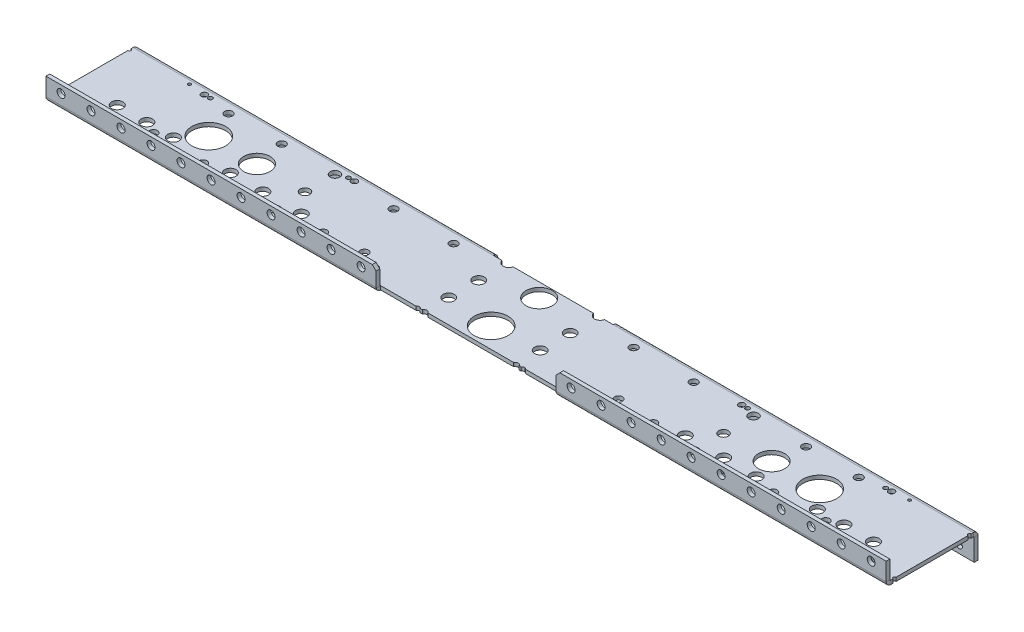
from build123d import *

# Parameters (mm, degrees)
SKETCH1_W                              = 812.8
SKETCH1_H                              = 69.85
BOSS_EXTRUDE1_DEPTH                    = 3.175
SKETCH3_R                              = 14.2875
CUT_EXTRUDE1_DEPTH                     = 816.802024467
EDGE_FLANGE1_DEPTH                     = 812.8
EDGE_FLANGE2_DEPTH                     = 812.8
SKETCH10_R                             = 4.826
LONG_6WD_DEPTH                         = 817.444922817
SKETCH11_R                             = 4.826
SHORT_6WD_DEPTH                        = 817.444922817
SKETCH12_R                             = 3.3528
F_8WD_EGG_DEPTH                        = 817.444922817
SKETCH13_R                             = 3.3528
LOWER_CHURRO_DEPTH                     = 817.444922817
SKETCH14_R                             = 2.667
UPPER_FLANGE_HP_DEPTH                  = 817.729920277
SKETCH16_R                             = 3.3528
LOWER_FLANGE_HP_DEPTH                  = 817.433889486
LPATTERN1_COUNT                        = 32
LPATTERN1_PITCH                        = 25.4
SKETCH17_W                             = 152.4
SKETCH17_H                             = 6.35
CUT_EXTRUDE9_DEPTH                     = 818.031193633
SKETCH18_W                             = 146.05
SKETCH18_H                             = 3.175
BOSS_EXTRUDE2_DEPTH                    = 19.05
SKETCH19_W                             = 101.6
SKETCH19_H                             = 3.937
CUT_EXTRUDE10_DEPTH                    = 818.031193633
SKETCH20_W                             = 95.25
SKETCH20_H                             = 3.175
BOSS_EXTRUDE3_DEPTH                    = 27.432
CUT_EXTRUDE14_DEPTH                    = 819.902667079
SKETCH21_R                             = 11.1125
SKETCH21_R_2                           = 4.7625
SKETCH21_R_3                           = 2.54
SKETCH21_R_4                           = 2.032
TB_MINI_SHAFT_PLATE_DEPTH              = 819.8226487
CUT_EXTRUDE12_DEPTH                    = 819.8226487
SKETCH23_R                             = 3.3528
UPPER_INTERNAL_CHIRRO_HP_DEPTH         = 819.8226487
SKETCH24_R                             = 1.27
CUTTING_GUIDES_DEPTH                   = 819.8226487
SKETCH26_R                             = 3.4036
SONIC_MOUNTING_HOLES_DEPTH             = 819.902667079
SKETCH29_R                             = 2.5527
SKETCH29_R_2                           = 1.7859375
SKETCH29_R_3                           = 14.2875
SKETCH29_R_4                           = 11.1125
SKETCH29_R_5                           = 4.064
TB_MICRO_MOUNTING_DEPTH                = 819.902667079
FILLET1_R                              = 3.175
CHAMFER1_SIZE                          = 3.175
SKETCH30_R                             = 3.3528
BOTTOM_CORNER_SUPPORT_USE_CHURRO_DEPTH = 819.902667079
SKETCH32_R                             = 3.3528
CUT_EXTRUDE15_DEPTH                    = 819.902667079
SKETCH33_R                             = 3.3528
CUT_EXTRUDE16_DEPTH                    = 819.902667079
CUT_EXTRUDE17_DEPTH                    = 819.902667079
CUT_EXTRUDE17_DEPTH_BACK               = 819.902667079
SKETCH35_W                             = 152.4
SKETCH35_H                             = 22.492003713
SKETCH35_W_2                           = 101.6
SKETCH35_H_2                           = 30.759297973
CUT_EXTRUDE18_DEPTH                    = 769.506173137


# Sheet-metal steps are written as plain solids
with BuildPart() as part:
    # Sketch1 → Boss-Extrude1 (new body)
    with BuildSketch(Plane(origin=(0, 0, 0), x_dir=(1, 0, 0), z_dir=(0, 1, 0))):
        with Locations((406.4, 34.925)):
            Rectangle(SKETCH1_W, SKETCH1_H)
    extrude(amount=BOSS_EXTRUDE1_DEPTH)

    # Sketch3 → Cut-Extrude1 (cut, through all)
    with BuildSketch(Plane(origin=(0, 3.175, 0), x_dir=(1, 0, 0), z_dir=(0, 1, 0))):
        with Locations(Location((406.4, 17.272, 0), (0, 0, 270))):
            Circle(SKETCH3_R)
    extrude(amount=-CUT_EXTRUDE1_DEPTH, mode=Mode.SUBTRACT)

    # Edge-Flange1 section (across the edge) → Edge-Flange1 (add)
    with BuildSketch(Plane(origin=(0, 3.175, 0.762), x_dir=(0, 0, -1), z_dir=(1, 0, 0))):
        with BuildLine():
            Line((-3.175, 0.762), (-3.175, 15.875))
            Line((-3.175, 15.875), (0, 15.875))
            Line((0, 15.875), (0, 0.762))
            ThreePointArc((0, 0.762), (0.223184633, 0.223184633), (0.762, 0))
            Line((0.762, 0), (0.762, -3.175))
            ThreePointArc((0.762, -3.175), (-2.021879398, -2.021879398), (-3.175, 0.762))
        make_face()
    extrude(amount=EDGE_FLANGE1_DEPTH)

    # Edge-Flange2 section (across the edge) → Edge-Flange2 (add)
    with BuildSketch(Plane(origin=(0, 0, -70.612), x_dir=(0, 0, 1), z_dir=(1, 0, 0))):
        with BuildLine():
            Line((-3.175, 0.762), (-3.175, 19.05))
            Line((-3.175, 19.05), (0, 19.05))
            Line((0, 19.05), (0, 0.762))
            ThreePointArc((0, 0.762), (0.223184633, 0.223184633), (0.762, 0))
            Line((0.762, 0), (0.762, -3.175))
            ThreePointArc((0.762, -3.175), (-2.021879398, -2.021879398), (-3.175, 0.762))
        make_face()
    extrude(amount=EDGE_FLANGE2_DEPTH)

    # Sketch10 → Long 6wd (cut, through all)
    with BuildSketch(Plane(origin=(0, 3.175, 0), x_dir=(1, 0, 0), z_dir=(0, 1, 0))):
        with Locations(Location((86.339113657, 20.828, 0), (0, 0, 270))):
            Circle(SKETCH10_R)
        with Locations(Location((111.349627997, 20.828, 0), (0, 0, 270))):
            Circle(SKETCH10_R)
        with Locations(Location((133.855797334, 20.828, 0), (0, 0, 270))):
            Circle(SKETCH10_R)
        with Locations(Location((726.460886343, 20.828, 0), (0, 0, 270))):
            Circle(SKETCH10_R)
        with Locations(Location((701.450372003, 20.828, 0), (0, 0, 270))):
            Circle(SKETCH10_R)
        with Locations(Location((678.944202666, 20.828, 0), (0, 0, 270))):
            Circle(SKETCH10_R)
    extrude(amount=-LONG_6WD_DEPTH, mode=Mode.SUBTRACT)

    # Sketch11 → Short 6wd (cut, through all)
    with BuildSketch(Plane(origin=(0, 3.175, 0), x_dir=(1, 0, 0), z_dir=(0, 1, 0))):
        with Locations(Location((183.852302373, 19.05, 0), (0, 0, 270))):
            Circle(SKETCH11_R)
        with Locations(Location((211.361504088, 19.05, 0), (0, 0, 270))):
            Circle(SKETCH11_R)
        with Locations(Location((243.875125248, 19.05, 0), (0, 0, 270))):
            Circle(SKETCH11_R)
        with Locations(Location((568.924874752, 19.05, 0), (0, 0, 270))):
            Circle(SKETCH11_R)
        with Locations(Location((601.438495912, 19.05, 0), (0, 0, 270))):
            Circle(SKETCH11_R)
        with Locations(Location((628.947697627, 19.05, 0), (0, 0, 270))):
            Circle(SKETCH11_R)
    extrude(amount=-SHORT_6WD_DEPTH, mode=Mode.SUBTRACT)

    # Sketch12 → 8wd egg (cut, through all)
    with BuildSketch(Plane(origin=(0, 3.175, 0), x_dir=(1, 0, 0), z_dir=(0, 1, 0))):
        with Locations(Location((298.874532383, 17.547282407, 0), (0, 0, 270))):
            Circle(SKETCH12_R)
        with Locations(Location((513.925467617, 17.547282407, 0), (0, 0, 270))):
            Circle(SKETCH12_R)
    extrude(amount=-F_8WD_EGG_DEPTH, mode=Mode.SUBTRACT)

    # Sketch13 → lower churro (cut, through all)
    with BuildSketch(Plane(origin=(0, 3.175, 0), x_dir=(1, 0, 0), z_dir=(0, 1, 0))):
        with Locations(Location((165.1, 14.732, 0), (0, 0, 270))):
            Circle(SKETCH13_R)
        with Locations(Location((266.7, 14.732, 0), (0, 0, 270))):
            Circle(SKETCH13_R)
        with Locations(Location((546.1, 14.732, 0), (0, 0, 270))):
            Circle(SKETCH13_R)
        with Locations(Location((647.7, 14.732, 0), (0, 0, 270))):
            Circle(SKETCH13_R)
    extrude(amount=-LOWER_CHURRO_DEPTH, mode=Mode.SUBTRACT)

    # Sketch14 → upper flange HP (cut, through all)
    with BuildSketch(Plane(origin=(0, 0, -73.787), x_dir=(-1, 0, 0), z_dir=(0, 0, -1))):
        with Locations(Location((-12.7, -12.7, 0), (0, 0, 90))):
            Circle(SKETCH14_R)
        with Locations(Location((-38.1, -12.7, 0), (0, 0, 90))):
            Circle(SKETCH14_R)
        with Locations(Location((-63.5, -12.7, 0), (0, 0, 90))):
            Circle(SKETCH14_R)
        with Locations(Location((-88.9, -12.7, 0), (0, 0, 90))):
            Circle(SKETCH14_R)
        with Locations(Location((-114.3, -12.7, 0), (0, 0, 90))):
            Circle(SKETCH14_R)
        with Locations(Location((-139.7, -12.7, 0), (0, 0, 90))):
            Circle(SKETCH14_R)
        with Locations(Location((-165.1, -12.7, 0), (0, 0, 90))):
            Circle(SKETCH14_R)
        with Locations(Location((-190.5, -12.7, 0), (0, 0, 90))):
            Circle(SKETCH14_R)
        with Locations(Location((-215.9, -12.7, 0), (0, 0, 90))):
            Circle(SKETCH14_R)
        with Locations(Location((-241.3, -12.7, 0), (0, 0, 90))):
            Circle(SKETCH14_R)
        with Locations(Location((-266.7, -12.7, 0), (0, 0, 90))):
            Circle(SKETCH14_R)
        with Locations(Location((-292.1, -12.7, 0), (0, 0, 90))):
            Circle(SKETCH14_R)
        with Locations(Location((-317.5, -12.7, 0), (0, 0, 90))):
            Circle(SKETCH14_R)
        with Locations(Location((-342.9, -12.7, 0), (0, 0, 90))):
            Circle(SKETCH14_R)
        with Locations(Location((-368.3, -12.7, 0), (0, 0, 90))):
            Circle(SKETCH14_R)
        with Locations(Location((-393.7, -12.7, 0), (0, 0, 90))):
            Circle(SKETCH14_R)
        with Locations(Location((-419.1, -12.7, 0), (0, 0, 90))):
            Circle(SKETCH14_R)
        with Locations(Location((-444.5, -12.7, 0), (0, 0, 90))):
            Circle(SKETCH14_R)
        with Locations(Location((-469.9, -12.7, 0), (0, 0, 90))):
            Circle(SKETCH14_R)
        with Locations(Location((-495.3, -12.7, 0), (0, 0, 90))):
            Circle(SKETCH14_R)
        with Locations(Location((-520.7, -12.7, 0), (0, 0, 90))):
            Circle(SKETCH14_R)
        with Locations(Location((-546.1, -12.7, 0), (0, 0, 90))):
            Circle(SKETCH14_R)
        with Locations(Location((-571.5, -12.7, 0), (0, 0, 90))):
            Circle(SKETCH14_R)
        with Locations(Location((-596.9, -12.7, 0), (0, 0, 90))):
            Circle(SKETCH14_R)
        with Locations(Location((-622.3, -12.7, 0), (0, 0, 90))):
            Circle(SKETCH14_R)
        with Locations(Location((-647.7, -12.7, 0), (0, 0, 90))):
            Circle(SKETCH14_R)
        with Locations(Location((-673.1, -12.7, 0), (0, 0, 90))):
            Circle(SKETCH14_R)
        with Locations(Location((-698.5, -12.7, 0), (0, 0, 90))):
            Circle(SKETCH14_R)
        with Locations(Location((-723.9, -12.7, 0), (0, 0, 90))):
            Circle(SKETCH14_R)
        with Locations(Location((-749.3, -12.7, 0), (0, 0, 90))):
            Circle(SKETCH14_R)
        with Locations(Location((-774.7, -12.7, 0), (0, 0, 90))):
            Circle(SKETCH14_R)
        with Locations(Location((-800.1, -12.7, 0), (0, 0, 90))):
            Circle(SKETCH14_R)
    extrude(amount=-UPPER_FLANGE_HP_DEPTH, mode=Mode.SUBTRACT)

    # Sketch16 → Lower flange HP (cut, through all)
    with BuildSketch(Plane(origin=(0, 0, 0.762), x_dir=(-1, 0, 0), z_dir=(0, 0, -1))):
        with Locations(Location((-12.7, 12.7, 0), (0, 0, 90))):
            Circle(SKETCH16_R)
    lower_flange_hp = extrude(amount=-LOWER_FLANGE_HP_DEPTH, mode=Mode.SUBTRACT)

    # LPattern1: Lower flange HP ×32
    with Locations(*[(i * LPATTERN1_PITCH, 0, 0) for i in range(1, LPATTERN1_COUNT)]):
        add(lower_flange_hp, mode=Mode.SUBTRACT)

    # Sketch17 → Cut-Extrude9 (cut, through all)
    with BuildSketch(Plane(origin=(0, 19.05, 0), x_dir=(1, 0, 0), z_dir=(0, 1, 0))):
        with Locations((406.4, -3.175)):
            Rectangle(SKETCH17_W, SKETCH17_H)
    extrude(amount=-CUT_EXTRUDE9_DEPTH, mode=Mode.SUBTRACT)

    # Sketch18 → Boss-Extrude2 (add)
    with BuildSketch(Plane.XY):
        with Locations((406.4, 1.5875)):
            Rectangle(SKETCH18_W, SKETCH18_H)
    extrude(amount=BOSS_EXTRUDE2_DEPTH)

    # Sketch19 → Cut-Extrude10 (cut, through all)
    with BuildSketch(Plane.XZ.offset(19.05)):
        with Locations((406.4, -71.8185)):
            Rectangle(SKETCH19_W, SKETCH19_H)
    extrude(amount=-CUT_EXTRUDE10_DEPTH, mode=Mode.SUBTRACT)

    # Sketch20 → Boss-Extrude3 (add)
    with BuildSketch(Plane(origin=(0, 0, -69.85), x_dir=(-1, 0, 0), z_dir=(0, 0, -1))):
        with Locations((-406.4, 1.5875)):
            Rectangle(SKETCH20_W, SKETCH20_H)
    extrude(amount=BOSS_EXTRUDE3_DEPTH)

    # Sketch27 → Cut-Extrude14 (cut, through all)
    with BuildSketch(Plane(origin=(0, 3.175, 0), x_dir=(1, 0, 0), z_dir=(0, 1, 0))):
        Polygon((333.375, 0), (344.373522628, -19.05), (333.375, -19.05), align=None)
        Polygon((479.425, 0), (479.425, -19.05), (468.426477372, -19.05), align=None)
    extrude(amount=-CUT_EXTRUDE14_DEPTH, mode=Mode.SUBTRACT)

    # Sketch21 → TB Mini Shaft plate (cut, through all)
    with BuildSketch(Plane.XZ):
        with Locations(Location((406.4, -57.9628, 0), (0, 0, 270))):
            Circle(SKETCH21_R)
        with Locations(Location((445.12429721, -45.466, 0), (0, 0, 270))):
            Circle(SKETCH21_R_2)
        with Locations(Location((367.67570279, -45.466, 0), (0, 0, 270))):
            Circle(SKETCH21_R_2)
        with Locations(Location((445.12429721, -70.866, 0), (0, 0, 270))):
            Circle(SKETCH21_R_2)
        with Locations(Location((445.12429721, -20.066, 0), (0, 0, 270))):
            Circle(SKETCH21_R_2)
        with Locations(Location((367.67570279, -20.066, 0), (0, 0, 270))):
            Circle(SKETCH21_R_2)
        with Locations(Location((367.67570279, -70.866, 0), (0, 0, 270))):
            Circle(SKETCH21_R_2)
        with Locations(Location((438.15, -87.85352, 0), (0, 0, 270))):
            Circle(SKETCH21_R_3)
        with Locations(Location((374.65, -87.85352, 0), (0, 0, 270))):
            Circle(SKETCH21_R_3)
        with Locations(Location((443.992, -87.85352, 0), (0, 0, 270))):
            Circle(SKETCH21_R_4)
        with Locations(Location((368.808, -87.85352, 0), (0, 0, 270))):
            Circle(SKETCH21_R_4)
        with Locations(Location((445.0461, 1.03886, 0), (0, 0, 270))):
            Circle(SKETCH21_R_3)
        with Locations(Location((367.7539, 1.03886, 0), (0, 0, 270))):
            Circle(SKETCH21_R_3)
        with Locations(Location((361.9119, 1.03886, 0), (0, 0, 270))):
            Circle(SKETCH21_R_4)
        with Locations(Location((450.8881, 1.03886, 0), (0, 0, 270))):
            Circle(SKETCH21_R_4)
    extrude(amount=-TB_MINI_SHAFT_PLATE_DEPTH, mode=Mode.SUBTRACT)

    # Sketch22 → Cut-Extrude12 (cut, through all)
    with BuildSketch(Plane.XZ):
        Polygon((454.025, -69.85), (444.579404912, -97.282), (454.025, -97.282), align=None)
        Polygon((358.775, -69.85), (368.220595088, -97.282), (358.775, -97.282), align=None)
    extrude(amount=-CUT_EXTRUDE12_DEPTH, mode=Mode.SUBTRACT)

    # Sketch23 → Upper internal chirro HP (cut, through all)
    with BuildSketch(Plane.XZ):
        with Locations(Location((330.2, -61.722, 0), (0, 0, 270))):
            Circle(SKETCH23_R)
        with Locations(Location((279.4, -61.722, 0), (0, 0, 270))):
            Circle(SKETCH23_R)
        with Locations(Location((139.7, -61.722, 0), (0, 0, 270))):
            Circle(SKETCH23_R)
        with Locations(Location((25.4, -61.722, 0), (0, 0, 270))):
            Circle(SKETCH23_R)
        with Locations(Location((482.6, -61.722, 0), (0, 0, 270))):
            Circle(SKETCH23_R)
        with Locations(Location((533.4, -61.722, 0), (0, 0, 270))):
            Circle(SKETCH23_R)
        with Locations(Location((673.1, -61.722, 0), (0, 0, 270))):
            Circle(SKETCH23_R)
        with Locations(Location((787.4, -61.722, 0), (0, 0, 270))):
            Circle(SKETCH23_R)
        with Locations(Location((6.35, -39.497, 0), (0, 0, 270))):
            Circle(SKETCH23_R)
        with Locations(Location((806.45, -39.497, 0), (0, 0, 270))):
            Circle(SKETCH23_R)
    extrude(amount=-UPPER_INTERNAL_CHIRRO_HP_DEPTH, mode=Mode.SUBTRACT)

    # Sketch24 → Cutting guides (cut, through all)
    with BuildSketch(Plane.XZ):
        with Locations(Location((101.6, -3.175, 0), (0, 0, 270))):
            Circle(SKETCH24_R)
        with Locations(Location((101.6, -66.675, 0), (0, 0, 270))):
            Circle(SKETCH24_R)
        with Locations(Location((50.8, -66.675, 0), (0, 0, 270))):
            Circle(SKETCH24_R)
        with Locations(Location((50.8, -3.175, 0), (0, 0, 270))):
            Circle(SKETCH24_R)
        with Locations(Location((762, -66.675, 0), (0, 0, 270))):
            Circle(SKETCH24_R)
        with Locations(Location((762, -3.175, 0), (0, 0, 270))):
            Circle(SKETCH24_R)
        with Locations(Location((711.2, -3.175, 0), (0, 0, 270))):
            Circle(SKETCH24_R)
        with Locations(Location((711.2, -66.675, 0), (0, 0, 270))):
            Circle(SKETCH24_R)
    extrude(amount=-CUTTING_GUIDES_DEPTH, mode=Mode.SUBTRACT)

    # Sketch26 → Sonic mounting holes (cut, through all)
    with BuildSketch(Plane(origin=(0, 3.175, 0), x_dir=(1, 0, 0), z_dir=(0, 1, 0))):
        with Locations(Location((350.8375, -12.8905, 0), (0, 0, 270))):
            Circle(SKETCH26_R)
        with Locations(Location((461.9625, -12.8905, 0), (0, 0, 270))):
            Circle(SKETCH26_R)
    extrude(amount=-SONIC_MOUNTING_HOLES_DEPTH, mode=Mode.SUBTRACT)

    # Sketch29 → TB Micro Mounting (cut, through all)
    with BuildSketch(Plane(origin=(0, 3.175, 0), x_dir=(1, 0, 0), z_dir=(0, 1, 0))):
        with Locations(Location((115.520362832, 65.405, 0), (0, 0, 270))):
            Circle(SKETCH29_R)
        with Locations(Location((120.600362832, 65.405, 0), (0, 0, 270))):
            Circle(SKETCH29_R_2)
        with Locations(Location((147.829162832, 36.83, 0), (0, 0, 270))):
            Circle(SKETCH29_R_3)
        with Locations(Location((115.520362832, 8.255, 0), (0, 0, 270))):
            Circle(SKETCH29_R)
        with Locations(Location((120.600362832, 8.255, 0), (0, 0, 270))):
            Circle(SKETCH29_R_2)
        with Locations(Location((188.545362832, 36.83, 0), (0, 0, 270))):
            Circle(SKETCH29_R_4)
        with Locations(Location((229.261562832, 36.83, 0), (0, 0, 270))):
            Circle(SKETCH29_R_5)
        with Locations(Location((229.261562832, 62.23, 0), (0, 0, 270))):
            Circle(SKETCH29_R_5)
        with Locations(Location((229.261562832, 11.43, 0), (0, 0, 270))):
            Circle(SKETCH29_R_5)
        with Locations(Location((237.440362832, 8.255, 0), (0, 0, 270))):
            Circle(SKETCH29_R_2)
        with Locations(Location((242.520362832, 8.255, 0), (0, 0, 270))):
            Circle(SKETCH29_R)
        with Locations(Location((237.440362832, 65.405, 0), (0, 0, 270))):
            Circle(SKETCH29_R_2)
        with Locations(Location((242.520362832, 65.405, 0), (0, 0, 270))):
            Circle(SKETCH29_R)
        with Locations(Location((570.279637168, 65.405, 0), (0, 0, 270))):
            Circle(SKETCH29_R)
        with Locations(Location((575.359637168, 65.405, 0), (0, 0, 270))):
            Circle(SKETCH29_R_2)
        with Locations(Location((583.538437168, 62.23, 0), (0, 0, 270))):
            Circle(SKETCH29_R_5)
        with Locations(Location((583.538437168, 36.83, 0), (0, 0, 270))):
            Circle(SKETCH29_R_5)
        with Locations(Location((624.254637168, 36.83, 0), (0, 0, 270))):
            Circle(SKETCH29_R_4)
        with Locations(Location((570.279637168, 8.255, 0), (0, 0, 270))):
            Circle(SKETCH29_R)
        with Locations(Location((575.359637168, 8.255, 0), (0, 0, 270))):
            Circle(SKETCH29_R_2)
        with Locations(Location((583.538437168, 11.43, 0), (0, 0, 270))):
            Circle(SKETCH29_R_5)
        with Locations(Location((664.970837168, 36.83, 0), (0, 0, 270))):
            Circle(SKETCH29_R_3)
        with Locations(Location((692.199637168, 65.405, 0), (0, 0, 270))):
            Circle(SKETCH29_R_2)
        with Locations(Location((697.279637168, 65.405, 0), (0, 0, 270))):
            Circle(SKETCH29_R)
        with Locations(Location((692.199637168, 8.255, 0), (0, 0, 270))):
            Circle(SKETCH29_R_2)
        with Locations(Location((697.279637168, 8.255, 0), (0, 0, 270))):
            Circle(SKETCH29_R)
    extrude(amount=-TB_MICRO_MOUNTING_DEPTH, mode=Mode.SUBTRACT)

    # Fillet1
    fillet1_edges = [part.edges().sort_by_distance(p)[0] for p in [
        (333.375, 1.5875, 0),
        (479.425, 1.5875, 0),
        (454.025, 1.5875, -69.85),
        (358.775, 1.5875, -69.85),
        (468.426477372, 1.5875, 19.05),
        (344.373522628, 1.5875, 19.05),
        (368.220595088, 1.5875, -97.282),
        (444.579404912, 1.5875, -97.282),
    ]]
    fillet(fillet1_edges, radius=FILLET1_R)

    # Chamfer1
    chamfer1_edges = [part.edges().sort_by_distance(p)[0] for p in [
        (0, 19.05, 2.3495),
        (812.8, 19.05, 2.3495),
        (482.6, 19.05, 2.3495),
        (330.2, 19.05, 2.3495),
        (0, -19.05, -72.1995),
        (812.8, -19.05, -72.1995),
        (355.6, -19.05, -72.1995),
        (457.2, -19.05, -72.1995),
    ]]
    chamfer(chamfer1_edges, length=CHAMFER1_SIZE)

    # Sketch30 → Bottom Corner Support (use churro) (cut, through all)
    with BuildSketch(Plane(origin=(0, 3.175, 0), x_dir=(1, 0, 0), z_dir=(0, 1, 0))):
        with Locations(Location((72.898, 9.525, 0), (0, 0, 270))):
            Circle(SKETCH30_R)
        with Locations(Location((121.92, 15.875, 0), (0, 0, 270))):
            Circle(SKETCH30_R)
        with Locations(Location((739.902, 9.525, 0), (0, 0, 90))):
            Circle(SKETCH30_R)
        with Locations(Location((690.88, 15.875, 0), (0, 0, 90))):
            Circle(SKETCH30_R)
    extrude(amount=-BOTTOM_CORNER_SUPPORT_USE_CHURRO_DEPTH, mode=Mode.SUBTRACT)

    # Sketch32 → Cut-Extrude15 (cut, through all)
    with BuildSketch(Plane(origin=(0, 3.175, 0), x_dir=(1, 0, 0), z_dir=(0, 1, 0))):
        with Locations(Location((184.480781416, 61.976, 0), (0, 0, 270))):
            Circle(SKETCH32_R)
        with Locations(Location((628.319218584, 61.976, 0), (0, 0, 90))):
            Circle(SKETCH32_R)
    extrude(amount=-CUT_EXTRUDE15_DEPTH, mode=Mode.SUBTRACT)

    # Sketch33 → Cut-Extrude16 (cut, through all)
    with BuildSketch(Plane(origin=(0, 3.175, 0), x_dir=(1, 0, 0), z_dir=(0, 1, 0))):
        with Locations(Location((200.025, 10.287, 0), (0, 0, 270))):
            Circle(SKETCH33_R)
        with Locations(Location((314.325, 10.287, 0), (0, 0, 270))):
            Circle(SKETCH33_R)
        with Locations(Location((498.475, 10.287, 0), (0, 0, 90))):
            Circle(SKETCH33_R)
        with Locations(Location((612.775, 10.287, 0), (0, 0, 90))):
            Circle(SKETCH33_R)
    extrude(amount=-CUT_EXTRUDE16_DEPTH, mode=Mode.SUBTRACT)

    # Sketch34 → Cut-Extrude17 (cut, two sides: drawn at the far end of the back side and taken through both)
    with BuildSketch(Plane(origin=(0, 3.175, 0), x_dir=(1, 0, 0), z_dir=(0, 1, 0)).offset(-CUT_EXTRUDE17_DEPTH_BACK)):
        Polygon((50.8, 66.675), (50.8, 3.175), (50.8, -3.937), (0, -3.937), (0, 73.787), (50.8, 73.787), align=None)
        Polygon((762, 66.675), (762, 4.445), (762, -3.937), (812.8, -3.937), (812.8, 73.787), (762, 73.787), align=None)
    extrude(amount=CUT_EXTRUDE17_DEPTH + CUT_EXTRUDE17_DEPTH_BACK, mode=Mode.SUBTRACT)

    # Sketch35 → Cut-Extrude18 (cut, through all)
    with BuildSketch(Plane(origin=(0, 3.175, 0), x_dir=(1, 0, 0), z_dir=(0, 1, 0))):
        with Locations((406.4, -11.246001857)):
            Rectangle(SKETCH35_W, SKETCH35_H)
        with Locations((406.4, 85.229648987)):
            Rectangle(SKETCH35_W_2, SKETCH35_H_2)
    extrude(amount=-CUT_EXTRUDE18_DEPTH, mode=Mode.SUBTRACT)


solid = part.part
